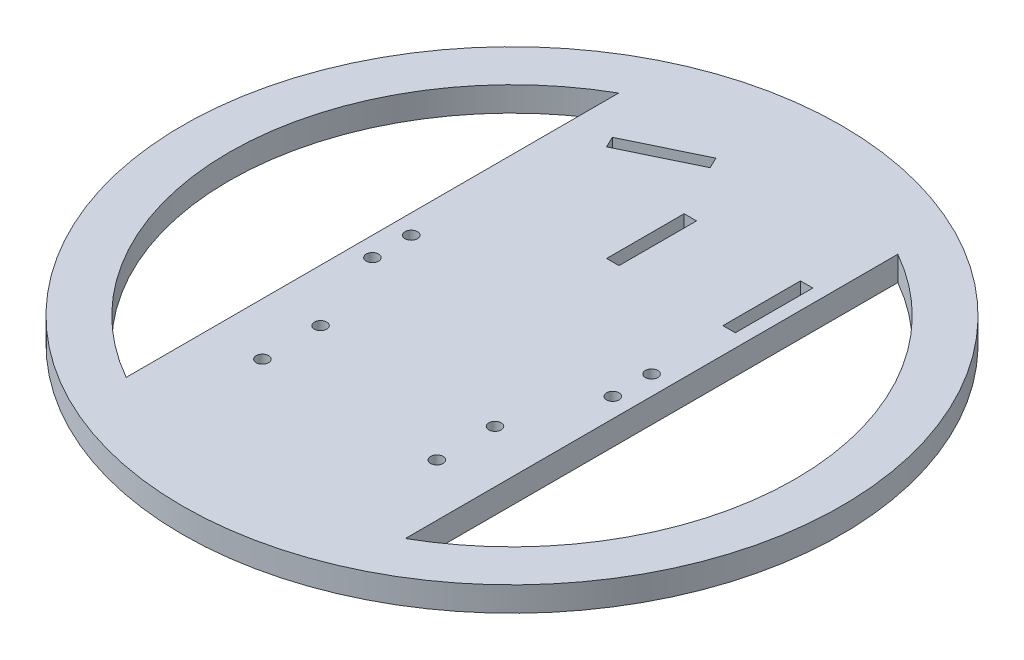
from build123d import *

# Parameters (mm, degrees)
SKETCH1_R                      = 85
SKETCH1_W                      = 3.2
SKETCH1_H                      = 20
BOSS_EXTRUDE1_DEPTH            = 6.35
CBORE_FOR_M3_SHCS1_D           = 3.2
CBORE_FOR_M3_SHCS1_CBORE_D     = 7.5
CBORE_FOR_M3_SHCS1_CBORE_DEPTH = 3.5
CBORE_FOR_M3_SHCS2_D           = 3.2
CBORE_FOR_M3_SHCS2_CBORE_D     = 7.5
CBORE_FOR_M3_SHCS2_CBORE_DEPTH = 3.5
SKETCH7_W                      = 8
SKETCH7_H                      = 38
SKETCH7_H_2                    = 28
CUT_EXTRUDE1_DEPTH             = 3.5


with BuildPart() as part:
    # Sketch1 → Boss-Extrude1 (new body)
    with BuildSketch(Plane(origin=(0, 0, 0), x_dir=(1, 0, 0), z_dir=(0, 1, 0))):
        Circle(SKETCH1_R)
        with BuildLine():
            Line((-36, 63.505905237), (-36, -63.505905237))
            ThreePointArc((-36, -63.505905237), (-73, 0), (-36, 63.505905237))
        make_face(mode=Mode.SUBTRACT)
        Polygon((-8.929608351, 61.508236296), (-26.933540277, 52.79856149), (-25.539992308, 49.917932382), (-7.536060382, 58.627607187), align=None, mode=Mode.SUBTRACT)
        with BuildLine():
            Line((36, 63.505905237), (36, -63.505905237))
            ThreePointArc((36, -63.505905237), (73, 0), (36, 63.505905237))
        make_face(mode=Mode.SUBTRACT)
        with Locations((1, 35)):
            Rectangle(SKETCH1_W, SKETCH1_H, mode=Mode.SUBTRACT)
        with Locations((31, 35)):
            Rectangle(SKETCH1_W, SKETCH1_H, mode=Mode.SUBTRACT)
    extrude(amount=BOSS_EXTRUDE1_DEPTH)

    # CBORE for M3 SHCS1 (through all)
    with Locations(Plane(origin=(0, 0, 0), x_dir=(-1, 0, 0), z_dir=(0, -1, 0))):
        with Locations((-31, 5), (-31, -5), (31, 5), (31, -5)):
            CounterBoreHole(CBORE_FOR_M3_SHCS1_D / 2, CBORE_FOR_M3_SHCS1_CBORE_D / 2, CBORE_FOR_M3_SHCS1_CBORE_DEPTH)

    # CBORE for M3 SHCS2 (through all)
    with Locations(Plane(origin=(0, 0, 0), x_dir=(-1, 0, 0), z_dir=(0, -1, 0))):
        with Locations((22.5, -26.887097638), (-22.5, -26.887097638), (22.5, -41.887097638), (-22.5, -41.887097638)):
            CounterBoreHole(CBORE_FOR_M3_SHCS2_D / 2, CBORE_FOR_M3_SHCS2_CBORE_D / 2, CBORE_FOR_M3_SHCS2_CBORE_DEPTH)

    # Sketch7 → Cut-Extrude1 (cut)
    with BuildSketch(Plane.XZ):
        with Locations((6.2, -20)):
            Rectangle(SKETCH7_W, SKETCH7_H)
        with Locations((-6.2, -20)):
            Rectangle(SKETCH7_W, SKETCH7_H)
        with Locations((-25, -50)):
            Rectangle(SKETCH7_W, SKETCH7_H_2)
        with Locations((25, -50)):
            Rectangle(SKETCH7_W, SKETCH7_H_2)
    extrude(amount=-CUT_EXTRUDE1_DEPTH, mode=Mode.SUBTRACT)


solid = part.part
